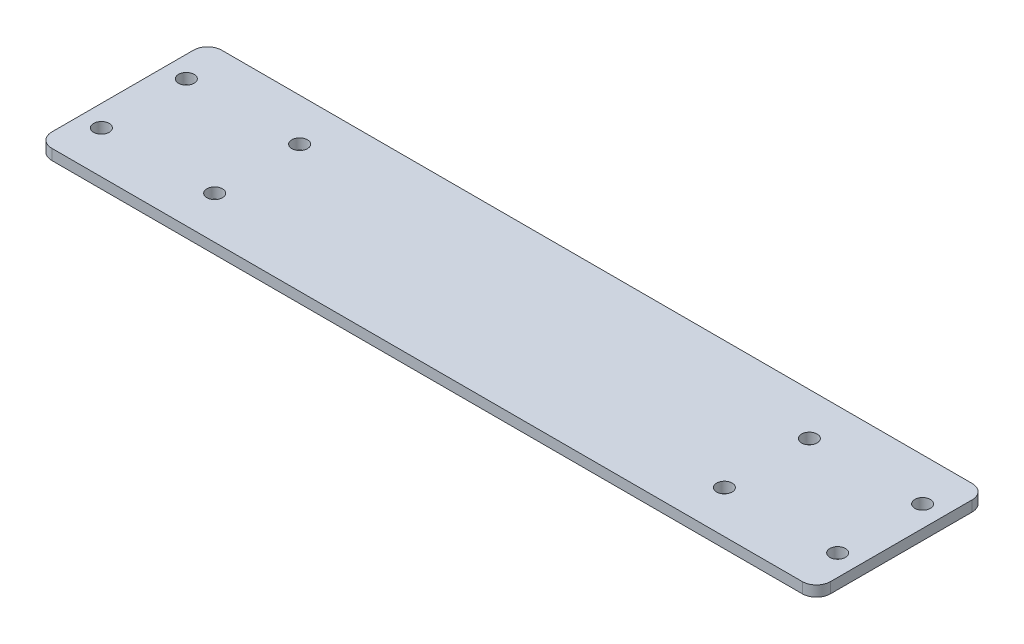
from build123d import *

# Parameters (mm, degrees)
SKETCH1_W          = 698.5
SKETCH1_H          = 152.4
SKETCH1_R          = 6.985
BASE_FLANGE1_DEPTH = 9.525
FILLET1_R          = 12.7


# Sheet-metal steps are written as plain solids
with BuildPart() as part:
    # Sketch1 → Base-Flange1 (new body)
    with BuildSketch(Plane(origin=(0, 0, 0), x_dir=(1, 0, 0), z_dir=(0, 1, 0))):
        Rectangle(SKETCH1_W, SKETCH1_H)
        with Locations(Location((228.6, 38.1, 0), (0, 0, 270))):
            Circle(SKETCH1_R, mode=Mode.SUBTRACT)
        with Locations(Location((330.2, 38.1, 0), (0, 0, 270))):
            Circle(SKETCH1_R, mode=Mode.SUBTRACT)
        with Locations(Location((330.2, -38.1, 0), (0, 0, 270))):
            Circle(SKETCH1_R, mode=Mode.SUBTRACT)
        with Locations(Location((228.6, -38.1, 0), (0, 0, 270))):
            Circle(SKETCH1_R, mode=Mode.SUBTRACT)
        with Locations(Location((-228.6, -38.1, 0), (0, 0, 270))):
            Circle(SKETCH1_R, mode=Mode.SUBTRACT)
        with Locations(Location((-330.2, -38.1, 0), (0, 0, 270))):
            Circle(SKETCH1_R, mode=Mode.SUBTRACT)
        with Locations(Location((-330.2, 38.1, 0), (0, 0, 270))):
            Circle(SKETCH1_R, mode=Mode.SUBTRACT)
        with Locations(Location((-228.6, 38.1, 0), (0, 0, 270))):
            Circle(SKETCH1_R, mode=Mode.SUBTRACT)
    extrude(amount=-BASE_FLANGE1_DEPTH)

    # Fillet1
    fillet1_edges = [part.edges().sort_by_distance(p)[0] for p in [
        (349.25, -4.7625, 76.2),
        (-349.25, -4.7625, 76.2),
        (-349.25, -4.7625, -76.2),
        (349.25, -4.7625, -76.2),
    ]]
    fillet(fillet1_edges, radius=FILLET1_R)


solid = part.part
